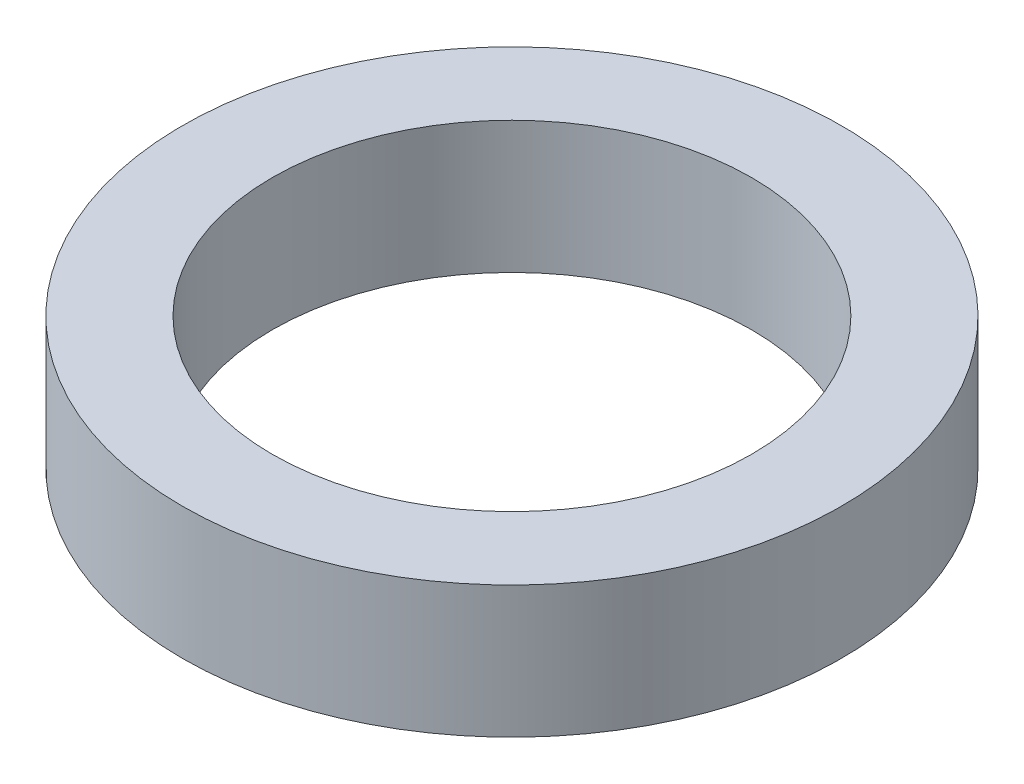
from build123d import *

# Parameters (mm, degrees)
SKETCH1_R           = 55
BOSS_EXTRUDE1_DEPTH = 22
SKETCH2_R           = 40
CUT_EXTRUDE1_DEPTH  = 81.833161512


with BuildPart() as part:
    # Sketch1 → Boss-Extrude1 (new body)
    with BuildSketch(Plane(origin=(0, 0, 0), x_dir=(1, 0, 0), z_dir=(0, 1, 0))):
        Circle(SKETCH1_R)
    extrude(amount=BOSS_EXTRUDE1_DEPTH)

    # Sketch2 → Cut-Extrude1 (cut, through all)
    with BuildSketch(Plane(origin=(0, 0, 0), x_dir=(1, 0, 0), z_dir=(0, 1, 0))):
        Circle(SKETCH2_R)
    extrude(amount=CUT_EXTRUDE1_DEPTH, mode=Mode.SUBTRACT)


solid = part.part
